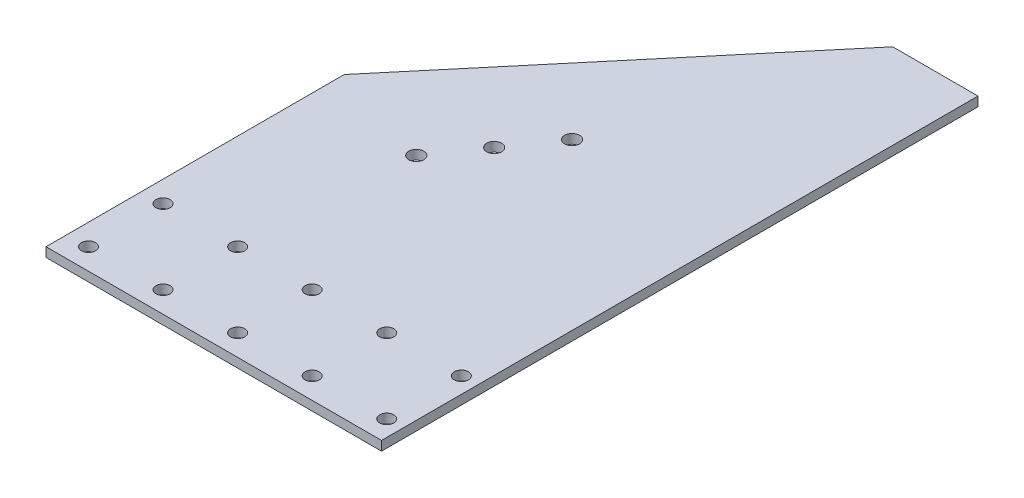
from build123d import *

# Parameters (mm, degrees)
SKETCH1_W           = 114.3
SKETCH1_H           = 203.2
BOSS_EXTRUDE1_DEPTH = 3.175
SKETCH2_R           = 2.413
CUT_EXTRUDE1_DEPTH  = 234.16262699
SKETCH3_R           = 2.5527
CUT_EXTRUDE2_DEPTH  = 234.16262699
CUT_EXTRUDE4_DEPTH  = 234.16262699


with BuildPart() as part:
    # Sketch1 → Boss-Extrude1 (new body)
    with BuildSketch(Plane(origin=(0, 0, 0), x_dir=(1, 0, 0), z_dir=(0, 1, 0))):
        with Locations((57.15, 101.6)):
            Rectangle(SKETCH1_W, SKETCH1_H)
    extrude(amount=BOSS_EXTRUDE1_DEPTH)

    # Sketch2 → Cut-Extrude1 (cut, through all)
    with BuildSketch(Plane(origin=(0, 3.175, 0), x_dir=(1, 0, 0), z_dir=(0, 1, 0))):
        with Locations((7.239, 7.239)):
            Circle(SKETCH2_R)
        with Locations((7.239, 32.639)):
            Circle(SKETCH2_R)
        with Locations((32.639, 32.639)):
            Circle(SKETCH2_R)
        with Locations((58.039, 32.639)):
            Circle(SKETCH2_R)
        with Locations((83.439, 32.639)):
            Circle(SKETCH2_R)
        with Locations((108.839, 32.639)):
            Circle(SKETCH2_R)
        with Locations((32.639, 7.239)):
            Circle(SKETCH2_R)
        with Locations((58.039, 7.239)):
            Circle(SKETCH2_R)
        with Locations((83.439, 7.239)):
            Circle(SKETCH2_R)
        with Locations((108.839, 7.239)):
            Circle(SKETCH2_R)
    extrude(amount=-CUT_EXTRUDE1_DEPTH, mode=Mode.SUBTRACT)

    # Sketch3 → Cut-Extrude2 (cut, through all)
    with BuildSketch(Plane(origin=(0, 3.175, 0), x_dir=(1, 0, 0), z_dir=(0, 1, 0))):
        with Locations((57.996383356, 121.202223647)):
            Circle(SKETCH3_R)
        with Locations((47.069752244, 105.597377203)):
            Circle(SKETCH3_R)
        with Locations((36.143121131, 89.99253076)):
            Circle(SKETCH3_R)
    extrude(amount=-CUT_EXTRUDE2_DEPTH, mode=Mode.SUBTRACT)

    # Sketch5 → Cut-Extrude4 (cut, through all)
    with BuildSketch(Plane(origin=(0, 0, 0), x_dir=(-1, 0, 0), z_dir=(0, -1, 0))):
        Polygon((-85.252522528, 203.2), (0, 101.6), (0, 203.2), align=None)
    extrude(amount=-CUT_EXTRUDE4_DEPTH, mode=Mode.SUBTRACT)


solid = part.part
